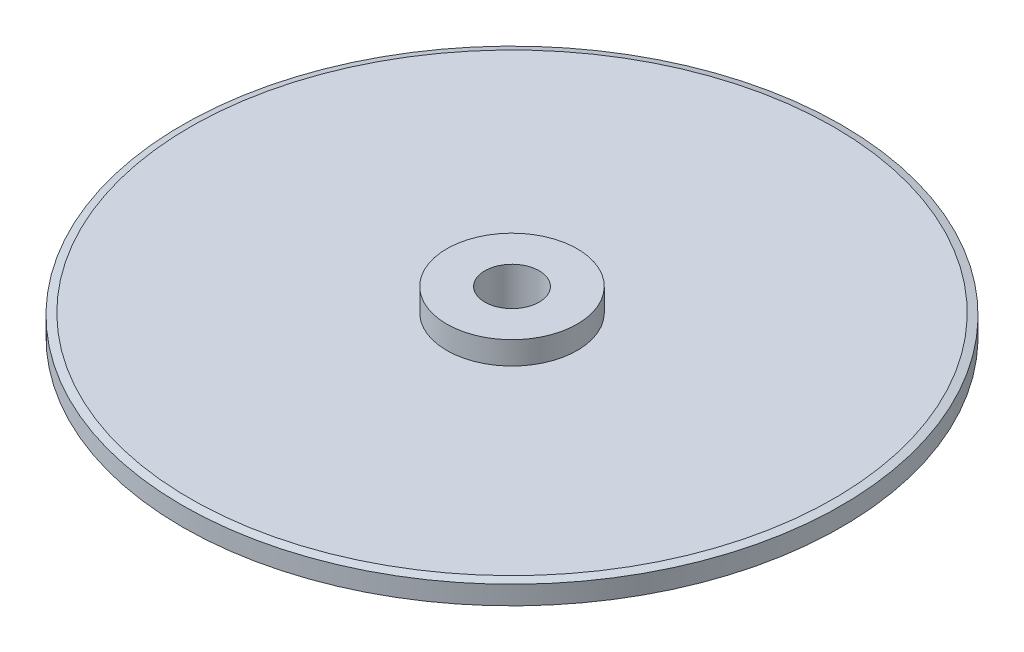
from build123d import *

# Parameters (mm, degrees)
CHAMFER_1_SIZE           = 1.41
CHAMFER_1_SIZE2          = 0.377808361
CHAMFER_2_SIZE           = 1.41
CHAMFER_2_SIZE2          = 0.377808361
CUT_EXTRUDE_3_DEPTH      = 87.112020067
CUT_EXTRUDE_3_DEPTH_BACK = 87.112020067
SKETCH_2_R               = 5


with BuildPart() as part:
    # Эскиз1 → Повернуть2 (revolve)
    with BuildSketch(Plane.XY):
        Polygon((0, 0), (60.6, 0), (60.6, 4.2), (12, 4.2), (12, 8.4), (0, 8.4), align=None)
    revolve(axis=Axis((0, 8.4, 0), (0, -1, 0)))

    # Фаска1
    chamfer_1_edges = [part.edges().sort_by_distance(p)[0] for p in [
        (-60.6, 4.2, 0),
    ]]
    chamfer_1_side = [part.faces().sort_by_distance(p)[0] for p in [
        (-58.885973162, 4.2, 0),
    ]]
    chamfer(chamfer_1_edges, length=CHAMFER_1_SIZE, length2=CHAMFER_1_SIZE2, reference=chamfer_1_side[0])

    # Фаска2
    chamfer_2_edges = [part.edges().sort_by_distance(p)[0] for p in [
        (-60.6, 0, 0),
    ]]
    chamfer_2_side = [part.faces().sort_by_distance(p)[0] for p in [
        (0, 0, 0),
    ]]
    chamfer(chamfer_2_edges, length=CHAMFER_2_SIZE, length2=CHAMFER_2_SIZE2, reference=chamfer_2_side[0])

    # Эскиз2 → Вырез-Вытянуть3 (cut, two sides: drawn at the far end of the back side and taken through both)
    with BuildSketch(Plane(origin=(0, 0, 0), x_dir=(-1, 0, 0), z_dir=(0, -1, 0)).offset(-CUT_EXTRUDE_3_DEPTH_BACK)):
        Circle(SKETCH_2_R)
    extrude(amount=CUT_EXTRUDE_3_DEPTH + CUT_EXTRUDE_3_DEPTH_BACK, mode=Mode.SUBTRACT)


solid = part.part
